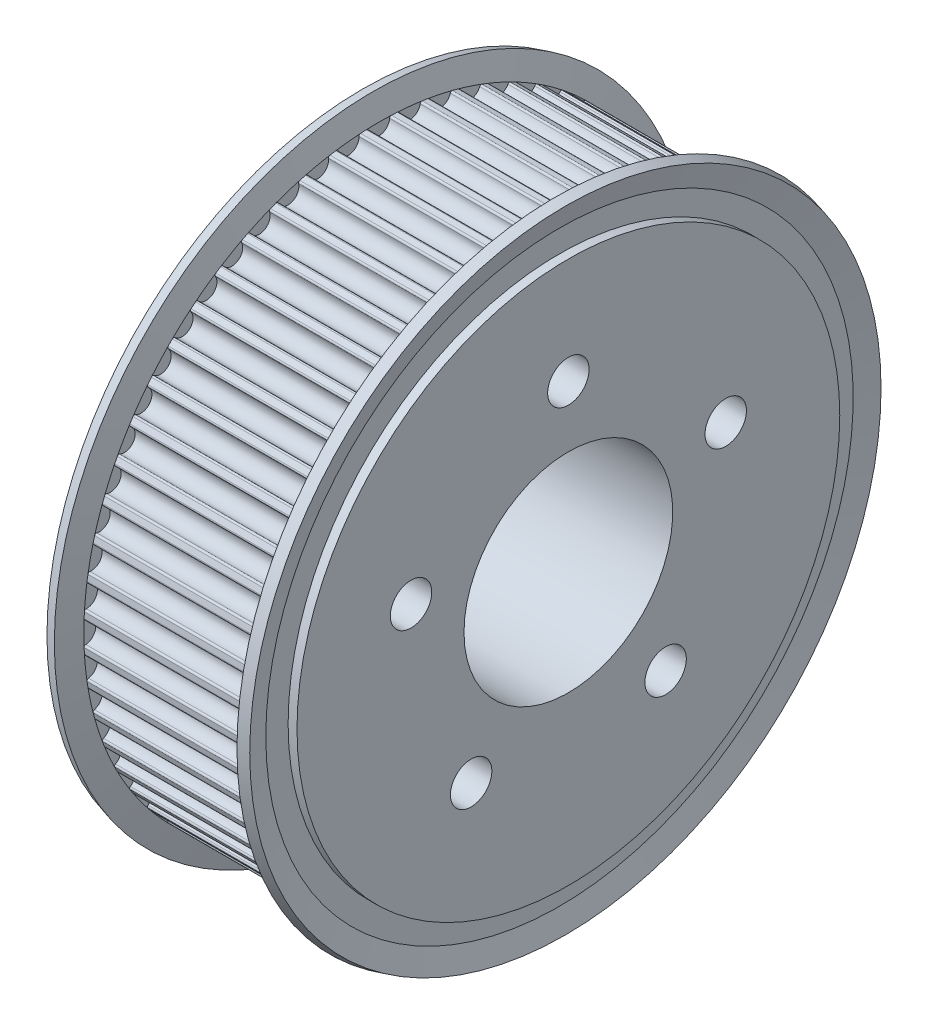
from build123d import *

# Parameters (mm, degrees)
CUT_EXTRUDE1_DEPTH       = 8.15
CUT_EXTRUDE1_DEPTH_BACK  = 8.15
CUT_EXTRUDE2_DEPTH       = 8.15
CUT_EXTRUDE2_DEPTH_BACK  = 8.15
CUT_EXTRUDE3_DEPTH       = 8.15
CUT_EXTRUDE3_DEPTH_BACK  = 8.15
CUT_EXTRUDE4_DEPTH       = 8.15
CUT_EXTRUDE4_DEPTH_BACK  = 8.15
CUT_EXTRUDE5_DEPTH       = 8.15
CUT_EXTRUDE5_DEPTH_BACK  = 8.15
CUT_EXTRUDE6_DEPTH       = 8.15
CUT_EXTRUDE6_DEPTH_BACK  = 8.15
CUT_EXTRUDE7_DEPTH       = 8.15
CUT_EXTRUDE7_DEPTH_BACK  = 8.15
CUT_EXTRUDE8_DEPTH       = 8.15
CUT_EXTRUDE8_DEPTH_BACK  = 8.15
CUT_EXTRUDE9_DEPTH       = 8.15
CUT_EXTRUDE9_DEPTH_BACK  = 8.15
CUT_EXTRUDE10_DEPTH      = 8.15
CUT_EXTRUDE10_DEPTH_BACK = 8.15
CUT_EXTRUDE11_DEPTH      = 8.15
CUT_EXTRUDE11_DEPTH_BACK = 8.15
CUT_EXTRUDE12_DEPTH      = 8.15
CUT_EXTRUDE12_DEPTH_BACK = 8.15
CUT_EXTRUDE13_DEPTH      = 8.15
CUT_EXTRUDE13_DEPTH_BACK = 8.15
CUT_EXTRUDE14_DEPTH      = 8.15
CUT_EXTRUDE14_DEPTH_BACK = 8.15
CUT_EXTRUDE15_DEPTH      = 8.15
CUT_EXTRUDE15_DEPTH_BACK = 8.15
CUT_EXTRUDE16_DEPTH      = 8.15
CUT_EXTRUDE16_DEPTH_BACK = 8.15
CUT_EXTRUDE17_DEPTH      = 8.15
CUT_EXTRUDE17_DEPTH_BACK = 8.15
CUT_EXTRUDE18_DEPTH      = 8.15
CUT_EXTRUDE18_DEPTH_BACK = 8.15
CUT_EXTRUDE19_DEPTH      = 8.15
CUT_EXTRUDE19_DEPTH_BACK = 8.15
CUT_EXTRUDE20_DEPTH      = 8.15
CUT_EXTRUDE20_DEPTH_BACK = 8.15
CUT_EXTRUDE21_DEPTH      = 8.15
CUT_EXTRUDE21_DEPTH_BACK = 8.15
CUT_EXTRUDE22_DEPTH      = 8.15
CUT_EXTRUDE22_DEPTH_BACK = 8.15
CUT_EXTRUDE23_DEPTH      = 8.15
CUT_EXTRUDE23_DEPTH_BACK = 8.15
CUT_EXTRUDE24_DEPTH      = 8.15
CUT_EXTRUDE24_DEPTH_BACK = 8.15
CUT_EXTRUDE25_DEPTH      = 8.15
CUT_EXTRUDE25_DEPTH_BACK = 8.15
CUT_EXTRUDE26_DEPTH      = 8.15
CUT_EXTRUDE26_DEPTH_BACK = 8.15
CUT_EXTRUDE27_DEPTH      = 8.15
CUT_EXTRUDE27_DEPTH_BACK = 8.15
CUT_EXTRUDE28_DEPTH      = 8.15
CUT_EXTRUDE28_DEPTH_BACK = 8.15
CUT_EXTRUDE29_DEPTH      = 8.15
CUT_EXTRUDE29_DEPTH_BACK = 8.15
CUT_EXTRUDE30_DEPTH      = 8.15
CUT_EXTRUDE30_DEPTH_BACK = 8.15
CUT_EXTRUDE31_DEPTH      = 8.15
CUT_EXTRUDE31_DEPTH_BACK = 8.15
CUT_EXTRUDE32_DEPTH      = 8.15
CUT_EXTRUDE32_DEPTH_BACK = 8.15
CUT_EXTRUDE33_DEPTH      = 8.15
CUT_EXTRUDE33_DEPTH_BACK = 8.15
CUT_EXTRUDE34_DEPTH      = 8.15
CUT_EXTRUDE34_DEPTH_BACK = 8.15
CUT_EXTRUDE35_DEPTH      = 8.15
CUT_EXTRUDE35_DEPTH_BACK = 8.15
CUT_EXTRUDE36_DEPTH      = 8.15
CUT_EXTRUDE36_DEPTH_BACK = 8.15
CUT_EXTRUDE37_DEPTH      = 8.15
CUT_EXTRUDE37_DEPTH_BACK = 8.15
CUT_EXTRUDE38_DEPTH      = 8.15
CUT_EXTRUDE38_DEPTH_BACK = 8.15
CUT_EXTRUDE39_DEPTH      = 8.15
CUT_EXTRUDE39_DEPTH_BACK = 8.15
CUT_EXTRUDE40_DEPTH      = 8.15
CUT_EXTRUDE40_DEPTH_BACK = 8.15
CUT_EXTRUDE41_DEPTH      = 8.15
CUT_EXTRUDE41_DEPTH_BACK = 8.15
CUT_EXTRUDE42_DEPTH      = 8.15
CUT_EXTRUDE42_DEPTH_BACK = 8.15
CUT_EXTRUDE43_DEPTH      = 8.15
CUT_EXTRUDE43_DEPTH_BACK = 8.15
CUT_EXTRUDE44_DEPTH      = 8.15
CUT_EXTRUDE44_DEPTH_BACK = 8.15
CUT_EXTRUDE45_DEPTH      = 8.15
CUT_EXTRUDE45_DEPTH_BACK = 8.15
CUT_EXTRUDE46_DEPTH      = 8.15
CUT_EXTRUDE46_DEPTH_BACK = 8.15
CUT_EXTRUDE47_DEPTH      = 8.15
CUT_EXTRUDE47_DEPTH_BACK = 8.15
CUT_EXTRUDE48_DEPTH      = 8.15
CUT_EXTRUDE48_DEPTH_BACK = 8.15
CUT_EXTRUDE49_DEPTH      = 8.15
CUT_EXTRUDE49_DEPTH_BACK = 8.15
CUT_EXTRUDE50_DEPTH      = 8.15
CUT_EXTRUDE50_DEPTH_BACK = 8.15
CUT_EXTRUDE51_DEPTH      = 8.15
CUT_EXTRUDE51_DEPTH_BACK = 8.15
CUT_EXTRUDE52_DEPTH      = 8.15
CUT_EXTRUDE52_DEPTH_BACK = 8.15
CUT_EXTRUDE53_DEPTH      = 8.15
CUT_EXTRUDE53_DEPTH_BACK = 8.15
CUT_EXTRUDE54_DEPTH      = 8.15
CUT_EXTRUDE54_DEPTH_BACK = 8.15
CUT_EXTRUDE55_DEPTH      = 8.15
CUT_EXTRUDE55_DEPTH_BACK = 8.15
CUT_EXTRUDE56_DEPTH      = 8.15
CUT_EXTRUDE56_DEPTH_BACK = 8.15
CUT_EXTRUDE57_DEPTH      = 8.15
CUT_EXTRUDE57_DEPTH_BACK = 8.15
CUT_EXTRUDE58_DEPTH      = 8.15
CUT_EXTRUDE58_DEPTH_BACK = 8.15
CUT_EXTRUDE59_DEPTH      = 8.15
CUT_EXTRUDE59_DEPTH_BACK = 8.15
CUT_EXTRUDE60_DEPTH      = 8.15
CUT_EXTRUDE60_DEPTH_BACK = 8.15
SKETCH62_W               = 20
SKETCH62_H               = 10
SKETCH63_R               = 1.984375
CUT_EXTRUDE61_DEPTH      = 18


with BuildPart() as part:
    # Sketch1 → Revolve1 (revolve)
    with BuildSketch(Plane.XY):
        Polygon((0, 0), (0, 26), (0.85, 26), (0.85, 28.138347502), (0.286547475, 30.241180955), (1.252473301, 30.5), (1.85, 28.27), (18.15, 28.27), (18.747526699, 30.5), (19.713452525, 30.241180955), (19.15, 28.138347502), (19.15, 26), (20, 26), (20, 0), align=None)
    revolve(axis=Axis((20, 0, 0), (-1, 0, 0)))

    # Sketch2 → Cut-Extrude1 (cut, two sides: drawn at the far end of the back side and taken through both)
    with BuildSketch(Plane(origin=(10, 0, 0), x_dir=(0, 0, -1), z_dir=(1, 0, 0)).offset(-CUT_EXTRUDE1_DEPTH_BACK)):
        with BuildLine():
            Line((-1.220377727, 28.623996545), (-1.204191216, 28.244341442))
            ThreePointArc((-1.204191216, 28.244341442), (-1.083780205, 28.201352445), (-1.027381979, 28.086608793))
            ThreePointArc((-1.027381979, 28.086608793), (5e-08, 27.13), (1.027381986, 28.086608894))
            ThreePointArc((1.027381986, 28.086608894), (1.083780242, 28.201352479), (1.204191216, 28.244341442))
            Line((1.204191216, 28.244341442), (1.220377727, 28.623996545))
            ThreePointArc((1.220377727, 28.623996545), (0, 28.65), (-1.220377727, 28.623996545))
        make_face()
    extrude(amount=CUT_EXTRUDE1_DEPTH + CUT_EXTRUDE1_DEPTH_BACK, mode=Mode.SUBTRACT)

    # Sketch3 → Cut-Extrude2 (cut, two sides: drawn at the far end of the back side and taken through both)
    with BuildSketch(Plane(origin=(10, 0, 0), x_dir=(0, 0, -1), z_dir=(1, 0, 0)).offset(-CUT_EXTRUDE2_DEPTH_BACK)):
        with BuildLine():
            Line((-4.205714742, 28.339627088), (-4.149932138, 27.963743727))
            ThreePointArc((-4.149932138, 27.963743727), (-4.025687177, 27.933576607), (-3.957603929, 27.825356752))
            ThreePointArc((-3.957603929, 27.825356752), (-2.835857158, 26.981379027), (-1.914096186, 28.040138172))
            ThreePointArc((-1.914096186, 28.040138172), (-1.870000856, 28.160148403), (-1.754743076, 28.215488242))
            Line((-1.754743076, 28.215488242), (-1.778330001, 28.594755505))
            ThreePointArc((-1.778330001, 28.594755505), (-2.994740473, 28.493052302), (-4.205714742, 28.339627088))
        make_face()
    extrude(amount=CUT_EXTRUDE2_DEPTH + CUT_EXTRUDE2_DEPTH_BACK, mode=Mode.SUBTRACT)

    # Sketch4 → Cut-Extrude3 (cut, two sides: drawn at the far end of the back side and taken through both)
    with BuildSketch(Plane(origin=(10, 0, 0), x_dir=(0, 0, -1), z_dir=(1, 0, 0)).offset(-CUT_EXTRUDE3_DEPTH_BACK)):
        with BuildLine():
            Line((-7.144973065, 27.744762747), (-7.050205534, 27.376769384))
            ThreePointArc((-7.050205534, 27.376769384), (-6.923487877, 27.359754657), (-6.844465541, 27.25924428))
            ThreePointArc((-6.844465541, 27.25924428), (-5.640644123, 26.537144418), (-4.83460312, 27.686453828))
            ThreePointArc((-4.83460312, 27.686453828), (-4.803293833, 27.810415847), (-4.694452036, 27.877500248))
            Line((-4.694452036, 27.877500248), (-4.757553974, 28.252224341))
            ThreePointArc((-4.757553974, 28.252224341), (-5.956669942, 28.023928761), (-7.144973065, 27.744762747))
        make_face()
    extrude(amount=CUT_EXTRUDE3_DEPTH + CUT_EXTRUDE3_DEPTH_BACK, mode=Mode.SUBTRACT)

    # Sketch5 → Cut-Extrude4 (cut, two sides: drawn at the far end of the back side and taken through both)
    with BuildSketch(Plane(origin=(10, 0, 0), x_dir=(0, 0, -1), z_dir=(1, 0, 0)).offset(-CUT_EXTRUDE4_DEPTH_BACK)):
        with BuildLine():
            Line((-10.005949569, 26.845920979), (-9.873235404, 26.489849427))
            ThreePointArc((-9.873235404, 26.489849427), (-9.745433396, 26.48617351), (-9.656337757, 26.394473822))
            ThreePointArc((-9.656337757, 26.394473822), (-8.383631009, 25.802163303), (-7.70214113, 27.029430903))
            ThreePointArc((-7.70214113, 27.029430903), (-7.683960919, 27.155986556), (-7.582727597, 27.234080528))
            Line((-7.582727597, 27.234080528), (-7.68465319, 27.600155894))
            ThreePointArc((-7.68465319, 27.600155894), (-8.853336889, 27.247769192), (-10.005949569, 26.845920979))
        make_face()
    extrude(amount=CUT_EXTRUDE4_DEPTH + CUT_EXTRUDE4_DEPTH_BACK, mode=Mode.SUBTRACT)

    # Sketch6 → Cut-Extrude5 (cut, two sides: drawn at the far end of the back side and taken through both)
    with BuildSketch(Plane(origin=(10, 0, 0), x_dir=(0, 0, -1), z_dir=(1, 0, 0)).offset(-CUT_EXTRUDE5_DEPTH_BACK)):
        with BuildLine():
            Line((-12.757298795, 25.652949683), (-12.58809204, 25.312701136))
            ThreePointArc((-12.58809204, 25.312701136), (-12.460605907, 25.322404304), (-12.362413116, 25.240519986))
            ThreePointArc((-12.362413116, 25.240519986), (-11.034765081, 24.784488286), (-10.48529287, 26.076267876))
            ThreePointArc((-10.48529287, 26.076267876), (-10.48044092, 26.204030594), (-10.387925208, 26.292278522))
            Line((-10.387925208, 26.292278522), (-10.527557737, 26.645694363))
            ThreePointArc((-10.527557737, 26.645694363), (-11.653004824, 26.173077361), (-12.757298795, 25.652949683))
        make_face()
    extrude(amount=CUT_EXTRUDE5_DEPTH + CUT_EXTRUDE5_DEPTH_BACK, mode=Mode.SUBTRACT)

    # Sketch7 → Cut-Extrude6 (cut, two sides: drawn at the far end of the back side and taken through both)
    with BuildSketch(Plane(origin=(10, 0, 0), x_dir=(0, 0, -1), z_dir=(1, 0, 0)).offset(-CUT_EXTRUDE6_DEPTH_BACK)):
        with BuildLine():
            Line((-15.368876386, 24.178919302), (-15.165030906, 23.858221594))
            ThreePointArc((-15.165030906, 23.858221594), (-15.039257412, 23.881197536), (-14.93304329, 23.810025732))
            ThreePointArc((-14.93304329, 23.810025732), (-13.564999956, 23.49526923), (-13.153565547, 24.837407801))
            ThreePointArc((-13.153565547, 24.837407801), (-13.162095017, 24.964977789), (-13.079310537, 25.06241281))
            Line((-13.079310537, 25.06241281), (-13.255120158, 25.399297029))
            ThreePointArc((-13.255120158, 25.399297029), (-14.325, 24.811627818), (-15.368876386, 24.178919302))
        make_face()
    extrude(amount=CUT_EXTRUDE6_DEPTH + CUT_EXTRUDE6_DEPTH_BACK, mode=Mode.SUBTRACT)

    # Sketch8 → Cut-Extrude7 (cut, two sides: drawn at the far end of the back side and taken through both)
    with BuildSketch(Plane(origin=(10, 0, 0), x_dir=(0, 0, -1), z_dir=(1, 0, 0)).offset(-CUT_EXTRUDE7_DEPTH_BACK)):
        with BuildLine():
            Line((-17.812069352, 22.439979621), (-17.575818519, 22.142346384))
            ThreePointArc((-17.575818519, 22.142346384), (-17.453135666, 22.178343372), (-17.340063916, 22.118663852))
            ThreePointArc((-17.340063916, 22.118663852), (-15.946613854, 21.948631087), (-15.677725008, 23.326423889))
            ThreePointArc((-15.677725008, 23.326423889), (-15.699542448, 23.452403463), (-15.627396202, 23.55795806))
            Line((-15.627396202, 23.55795806), (-15.83745671, 23.874619682))
            ThreePointArc((-15.83745671, 23.874619682), (-16.840047478, 23.178336889), (-17.812069352, 22.439979621))
        make_face()
    extrude(amount=CUT_EXTRUDE7_DEPTH + CUT_EXTRUDE7_DEPTH_BACK, mode=Mode.SUBTRACT)

    # Sketch9 → Cut-Extrude8 (cut, two sides: drawn at the far end of the back side and taken through both)
    with BuildSketch(Plane(origin=(10, 0, 0), x_dir=(0, 0, -1), z_dir=(1, 0, 0)).offset(-CUT_EXTRUDE8_DEPTH_BACK)):
        with BuildLine():
            Line((-20.060109558, 20.455182828), (-19.794041787, 20.183874993))
            ThreePointArc((-19.794041787, 20.183874993), (-19.675793713, 20.232498636), (-19.557103174, 20.184965263))
            ThreePointArc((-19.557103174, 20.184965263), (-18.153513313, 20.161519149), (-18.030116033, 21.559870796))
            ThreePointArc((-18.030116033, 21.559870796), (-18.064982405, 21.682879697), (-18.004264844, 21.795397391))
            Line((-18.004264844, 21.795397391), (-18.246274771, 22.088367005))
            ThreePointArc((-18.246274771, 22.088367005), (-19.170591872, 21.29109925), (-20.060109558, 20.455182828))
        make_face()
    extrude(amount=CUT_EXTRUDE8_DEPTH + CUT_EXTRUDE8_DEPTH_BACK, mode=Mode.SUBTRACT)

    # Sketch10 → Cut-Extrude9 (cut, two sides: drawn at the far end of the back side and taken through both)
    with BuildSketch(Plane(origin=(10, 0, 0), x_dir=(0, 0, -1), z_dir=(1, 0, 0)).offset(-CUT_EXTRUDE9_DEPTH_BACK)):
        with BuildLine():
            Line((-22.088367005, 18.246274771), (-21.795397391, 18.004264844))
            ThreePointArc((-21.795397391, 18.004264844), (-21.682879647, 18.064982411), (-21.559870717, 18.030115971))
            ThreePointArc((-21.559870717, 18.030115971), (-20.161519081, 18.153513388), (-20.184965333, 19.557103247))
            ThreePointArc((-20.184965333, 19.557103247), (-20.232498635, 19.675793763), (-20.183874993, 19.794041787))
            Line((-20.183874993, 19.794041787), (-20.455182828, 20.060109558))
            ThreePointArc((-20.455182828, 20.060109558), (-21.29109925, 19.170591872), (-22.088367005, 18.246274771))
        make_face()
    extrude(amount=CUT_EXTRUDE9_DEPTH + CUT_EXTRUDE9_DEPTH_BACK, mode=Mode.SUBTRACT)

    # Sketch11 → Cut-Extrude10 (cut, two sides: drawn at the far end of the back side and taken through both)
    with BuildSketch(Plane(origin=(10, 0, 0), x_dir=(0, 0, -1), z_dir=(1, 0, 0)).offset(-CUT_EXTRUDE10_DEPTH_BACK)):
        with BuildLine():
            Line((-23.874619682, 15.83745671), (-23.55795806, 15.627396202))
            ThreePointArc((-23.55795806, 15.627396202), (-23.452403414, 15.699542458), (-23.326423804, 15.677724955))
            ThreePointArc((-23.326423804, 15.677724955), (-21.948631028, 15.946613935), (-22.11866393, 17.340063981))
            ThreePointArc((-22.11866393, 17.340063981), (-22.178343377, 17.453135716), (-22.142346384, 17.575818519))
            Line((-22.142346384, 17.575818519), (-22.439979621, 17.812069352))
            ThreePointArc((-22.439979621, 17.812069352), (-23.178336889, 16.840047478), (-23.874619682, 15.83745671))
        make_face()
    extrude(amount=CUT_EXTRUDE10_DEPTH + CUT_EXTRUDE10_DEPTH_BACK, mode=Mode.SUBTRACT)

    # Sketch12 → Cut-Extrude11 (cut, two sides: drawn at the far end of the back side and taken through both)
    with BuildSketch(Plane(origin=(10, 0, 0), x_dir=(0, 0, -1), z_dir=(1, 0, 0)).offset(-CUT_EXTRUDE11_DEPTH_BACK)):
        with BuildLine():
            Line((-25.399297029, 13.255120158), (-25.06241281, 13.079310537))
            ThreePointArc((-25.06241281, 13.079310537), (-24.964977741, 13.162095033), (-24.837407711, 13.153565503))
            ThreePointArc((-24.837407711, 13.153565503), (-23.495269179, 13.565000044), (-23.810025815, 14.933043346))
            ThreePointArc((-23.810025815, 14.933043346), (-23.881197547, 15.039257461), (-23.858221594, 15.165030906))
            Line((-23.858221594, 15.165030906), (-24.178919302, 15.368876386))
            ThreePointArc((-24.178919302, 15.368876386), (-24.811627818, 14.325), (-25.399297029, 13.255120158))
        make_face()
    extrude(amount=CUT_EXTRUDE11_DEPTH + CUT_EXTRUDE11_DEPTH_BACK, mode=Mode.SUBTRACT)

    # Sketch13 → Cut-Extrude12 (cut, two sides: drawn at the far end of the back side and taken through both)
    with BuildSketch(Plane(origin=(10, 0, 0), x_dir=(0, 0, -1), z_dir=(1, 0, 0)).offset(-CUT_EXTRUDE12_DEPTH_BACK)):
        with BuildLine():
            Line((-26.645694363, 10.527557737), (-26.292278522, 10.387925208))
            ThreePointArc((-26.292278522, 10.387925208), (-26.204030548, 10.480440941), (-26.076267781, 10.485292836))
            ThreePointArc((-26.076267781, 10.485292836), (-24.784488245, 11.034765173), (-25.240520075, 12.362413164))
            ThreePointArc((-25.240520075, 12.362413164), (-25.322404319, 12.460605955), (-25.312701136, 12.58809204))
            Line((-25.312701136, 12.58809204), (-25.652949683, 12.757298795))
            ThreePointArc((-25.652949683, 12.757298795), (-26.173077361, 11.653004824), (-26.645694363, 10.527557737))
        make_face()
    extrude(amount=CUT_EXTRUDE12_DEPTH + CUT_EXTRUDE12_DEPTH_BACK, mode=Mode.SUBTRACT)

    # Sketch14 → Cut-Extrude13 (cut, two sides: drawn at the far end of the back side and taken through both)
    with BuildSketch(Plane(origin=(10, 0, 0), x_dir=(0, 0, -1), z_dir=(1, 0, 0)).offset(-CUT_EXTRUDE13_DEPTH_BACK)):
        with BuildLine():
            Line((-27.600155894, 7.68465319), (-27.234080528, 7.582727597))
            ThreePointArc((-27.234080528, 7.582727597), (-27.155986513, 7.683960944), (-27.029430805, 7.702141106))
            ThreePointArc((-27.029430805, 7.702141106), (-25.802163272, 8.383631105), (-26.394473916, 9.656337795))
            ThreePointArc((-26.394473916, 9.656337795), (-26.48617353, 9.745433442), (-26.489849427, 9.873235404))
            Line((-26.489849427, 9.873235404), (-26.845920979, 10.005949569))
            ThreePointArc((-26.845920979, 10.005949569), (-27.247769192, 8.853336889), (-27.600155894, 7.68465319))
        make_face()
    extrude(amount=CUT_EXTRUDE13_DEPTH + CUT_EXTRUDE13_DEPTH_BACK, mode=Mode.SUBTRACT)

    # Sketch15 → Cut-Extrude14 (cut, two sides: drawn at the far end of the back side and taken through both)
    with BuildSketch(Plane(origin=(10, 0, 0), x_dir=(0, 0, -1), z_dir=(1, 0, 0)).offset(-CUT_EXTRUDE14_DEPTH_BACK)):
        with BuildLine():
            Line((-28.252224341, 4.757553974), (-27.877500248, 4.694452036))
            ThreePointArc((-27.877500248, 4.694452036), (-27.810415807, 4.803293863), (-27.686453728, 4.834603106))
            ThreePointArc((-27.686453728, 4.834603106), (-26.537144397, 5.640644221), (-27.259244376, 6.844465569))
            ThreePointArc((-27.259244376, 6.844465569), (-27.359754682, 6.923487921), (-27.376769384, 7.050205534))
            Line((-27.376769384, 7.050205534), (-27.744762747, 7.144973065))
            ThreePointArc((-27.744762747, 7.144973065), (-28.023928761, 5.956669942), (-28.252224341, 4.757553974))
        make_face()
    extrude(amount=CUT_EXTRUDE14_DEPTH + CUT_EXTRUDE14_DEPTH_BACK, mode=Mode.SUBTRACT)

    # Sketch16 → Cut-Extrude15 (cut, two sides: drawn at the far end of the back side and taken through both)
    with BuildSketch(Plane(origin=(10, 0, 0), x_dir=(0, 0, -1), z_dir=(1, 0, 0)).offset(-CUT_EXTRUDE15_DEPTH_BACK)):
        with BuildLine():
            Line((-28.594755505, 1.778330001), (-28.215488242, 1.754743076))
            ThreePointArc((-28.215488242, 1.754743076), (-28.160148365, 1.87000089), (-28.040138071, 1.914096183))
            ThreePointArc((-28.040138071, 1.914096183), (-26.981379016, 2.835857259), (-27.825356851, 3.957603946))
            ThreePointArc((-27.825356851, 3.957603946), (-27.933576636, 4.025687218), (-27.963743727, 4.149932138))
            Line((-27.963743727, 4.149932138), (-28.339627088, 4.205714742))
            ThreePointArc((-28.339627088, 4.205714742), (-28.493052302, 2.994740473), (-28.594755505, 1.778330001))
        make_face()
    extrude(amount=CUT_EXTRUDE15_DEPTH + CUT_EXTRUDE15_DEPTH_BACK, mode=Mode.SUBTRACT)

    # Sketch17 → Cut-Extrude16 (cut, two sides: drawn at the far end of the back side and taken through both)
    with BuildSketch(Plane(origin=(10, 0, 0), x_dir=(0, 0, -1), z_dir=(1, 0, 0)).offset(-CUT_EXTRUDE16_DEPTH_BACK)):
        with BuildLine():
            Line((-28.623996545, -1.220377727), (-28.244341442, -1.204191216))
            ThreePointArc((-28.244341442, -1.204191216), (-28.201352445, -1.083780205), (-28.086608793, -1.027381979))
            ThreePointArc((-28.086608793, -1.027381979), (-27.13, 5e-08), (-28.086608894, 1.027381986))
            ThreePointArc((-28.086608894, 1.027381986), (-28.201352479, 1.083780242), (-28.244341442, 1.204191216))
            Line((-28.244341442, 1.204191216), (-28.623996545, 1.220377727))
            ThreePointArc((-28.623996545, 1.220377727), (-28.65, 0), (-28.623996545, -1.220377727))
        make_face()
    extrude(amount=CUT_EXTRUDE16_DEPTH + CUT_EXTRUDE16_DEPTH_BACK, mode=Mode.SUBTRACT)

    # Sketch18 → Cut-Extrude17 (cut, two sides: drawn at the far end of the back side and taken through both)
    with BuildSketch(Plane(origin=(10, 0, 0), x_dir=(0, 0, -1), z_dir=(1, 0, 0)).offset(-CUT_EXTRUDE17_DEPTH_BACK)):
        with BuildLine():
            Line((-28.339627088, -4.205714742), (-27.963743727, -4.149932138))
            ThreePointArc((-27.963743727, -4.149932138), (-27.933576607, -4.025687177), (-27.825356752, -3.957603929))
            ThreePointArc((-27.825356752, -3.957603929), (-26.981379027, -2.835857158), (-28.040138172, -1.914096186))
            ThreePointArc((-28.040138172, -1.914096186), (-28.160148403, -1.870000856), (-28.215488242, -1.754743076))
            Line((-28.215488242, -1.754743076), (-28.594755505, -1.778330001))
            ThreePointArc((-28.594755505, -1.778330001), (-28.493052302, -2.994740473), (-28.339627088, -4.205714742))
        make_face()
    extrude(amount=CUT_EXTRUDE17_DEPTH + CUT_EXTRUDE17_DEPTH_BACK, mode=Mode.SUBTRACT)

    # Sketch19 → Cut-Extrude18 (cut, two sides: drawn at the far end of the back side and taken through both)
    with BuildSketch(Plane(origin=(10, 0, 0), x_dir=(0, 0, -1), z_dir=(1, 0, 0)).offset(-CUT_EXTRUDE18_DEPTH_BACK)):
        with BuildLine():
            Line((-27.744762747, -7.144973065), (-27.376769384, -7.050205534))
            ThreePointArc((-27.376769384, -7.050205534), (-27.359754657, -6.923487877), (-27.25924428, -6.844465541))
            ThreePointArc((-27.25924428, -6.844465541), (-26.537144418, -5.640644123), (-27.686453828, -4.83460312))
            ThreePointArc((-27.686453828, -4.83460312), (-27.810415847, -4.803293833), (-27.877500248, -4.694452036))
            Line((-27.877500248, -4.694452036), (-28.252224341, -4.757553974))
            ThreePointArc((-28.252224341, -4.757553974), (-28.023928761, -5.956669942), (-27.744762747, -7.144973065))
        make_face()
    extrude(amount=CUT_EXTRUDE18_DEPTH + CUT_EXTRUDE18_DEPTH_BACK, mode=Mode.SUBTRACT)

    # Sketch20 → Cut-Extrude19 (cut, two sides: drawn at the far end of the back side and taken through both)
    with BuildSketch(Plane(origin=(10, 0, 0), x_dir=(0, 0, -1), z_dir=(1, 0, 0)).offset(-CUT_EXTRUDE19_DEPTH_BACK)):
        with BuildLine():
            Line((-26.845920979, -10.005949569), (-26.489849427, -9.873235404))
            ThreePointArc((-26.489849427, -9.873235404), (-26.48617351, -9.745433396), (-26.394473822, -9.656337757))
            ThreePointArc((-26.394473822, -9.656337757), (-25.802163303, -8.383631009), (-27.029430903, -7.70214113))
            ThreePointArc((-27.029430903, -7.70214113), (-27.155986556, -7.683960919), (-27.234080528, -7.582727597))
            Line((-27.234080528, -7.582727597), (-27.600155894, -7.68465319))
            ThreePointArc((-27.600155894, -7.68465319), (-27.247769192, -8.853336889), (-26.845920979, -10.005949569))
        make_face()
    extrude(amount=CUT_EXTRUDE19_DEPTH + CUT_EXTRUDE19_DEPTH_BACK, mode=Mode.SUBTRACT)

    # Sketch21 → Cut-Extrude20 (cut, two sides: drawn at the far end of the back side and taken through both)
    with BuildSketch(Plane(origin=(10, 0, 0), x_dir=(0, 0, -1), z_dir=(1, 0, 0)).offset(-CUT_EXTRUDE20_DEPTH_BACK)):
        with BuildLine():
            Line((-25.652949683, -12.757298795), (-25.312701136, -12.58809204))
            ThreePointArc((-25.312701136, -12.58809204), (-25.322404304, -12.460605907), (-25.240519986, -12.362413116))
            ThreePointArc((-25.240519986, -12.362413116), (-24.784488286, -11.034765081), (-26.076267876, -10.48529287))
            ThreePointArc((-26.076267876, -10.48529287), (-26.204030594, -10.48044092), (-26.292278522, -10.387925208))
            Line((-26.292278522, -10.387925208), (-26.645694363, -10.527557737))
            ThreePointArc((-26.645694363, -10.527557737), (-26.173077361, -11.653004824), (-25.652949683, -12.757298795))
        make_face()
    extrude(amount=CUT_EXTRUDE20_DEPTH + CUT_EXTRUDE20_DEPTH_BACK, mode=Mode.SUBTRACT)

    # Sketch22 → Cut-Extrude21 (cut, two sides: drawn at the far end of the back side and taken through both)
    with BuildSketch(Plane(origin=(10, 0, 0), x_dir=(0, 0, -1), z_dir=(1, 0, 0)).offset(-CUT_EXTRUDE21_DEPTH_BACK)):
        with BuildLine():
            Line((-24.178919302, -15.368876386), (-23.858221594, -15.165030906))
            ThreePointArc((-23.858221594, -15.165030906), (-23.881197536, -15.039257412), (-23.810025732, -14.93304329))
            ThreePointArc((-23.810025732, -14.93304329), (-23.49526923, -13.564999956), (-24.837407801, -13.153565547))
            ThreePointArc((-24.837407801, -13.153565547), (-24.964977789, -13.162095017), (-25.06241281, -13.079310537))
            Line((-25.06241281, -13.079310537), (-25.399297029, -13.255120158))
            ThreePointArc((-25.399297029, -13.255120158), (-24.811627818, -14.325), (-24.178919302, -15.368876386))
        make_face()
    extrude(amount=CUT_EXTRUDE21_DEPTH + CUT_EXTRUDE21_DEPTH_BACK, mode=Mode.SUBTRACT)

    # Sketch23 → Cut-Extrude22 (cut, two sides: drawn at the far end of the back side and taken through both)
    with BuildSketch(Plane(origin=(10, 0, 0), x_dir=(0, 0, -1), z_dir=(1, 0, 0)).offset(-CUT_EXTRUDE22_DEPTH_BACK)):
        with BuildLine():
            Line((-22.439979621, -17.812069352), (-22.142346384, -17.575818519))
            ThreePointArc((-22.142346384, -17.575818519), (-22.178343372, -17.453135666), (-22.118663852, -17.340063916))
            ThreePointArc((-22.118663852, -17.340063916), (-21.948631087, -15.946613854), (-23.326423889, -15.677725008))
            ThreePointArc((-23.326423889, -15.677725008), (-23.452403463, -15.699542448), (-23.55795806, -15.627396202))
            Line((-23.55795806, -15.627396202), (-23.874619682, -15.83745671))
            ThreePointArc((-23.874619682, -15.83745671), (-23.178336889, -16.840047478), (-22.439979621, -17.812069352))
        make_face()
    extrude(amount=CUT_EXTRUDE22_DEPTH + CUT_EXTRUDE22_DEPTH_BACK, mode=Mode.SUBTRACT)

    # Sketch24 → Cut-Extrude23 (cut, two sides: drawn at the far end of the back side and taken through both)
    with BuildSketch(Plane(origin=(10, 0, 0), x_dir=(0, 0, -1), z_dir=(1, 0, 0)).offset(-CUT_EXTRUDE23_DEPTH_BACK)):
        with BuildLine():
            Line((-20.455182828, -20.060109558), (-20.183874993, -19.794041787))
            ThreePointArc((-20.183874993, -19.794041787), (-20.232498636, -19.675793713), (-20.184965263, -19.557103174))
            ThreePointArc((-20.184965263, -19.557103174), (-20.161519149, -18.153513313), (-21.559870796, -18.030116033))
            ThreePointArc((-21.559870796, -18.030116033), (-21.682879697, -18.064982405), (-21.795397391, -18.004264844))
            Line((-21.795397391, -18.004264844), (-22.088367005, -18.246274771))
            ThreePointArc((-22.088367005, -18.246274771), (-21.29109925, -19.170591872), (-20.455182828, -20.060109558))
        make_face()
    extrude(amount=CUT_EXTRUDE23_DEPTH + CUT_EXTRUDE23_DEPTH_BACK, mode=Mode.SUBTRACT)

    # Sketch25 → Cut-Extrude24 (cut, two sides: drawn at the far end of the back side and taken through both)
    with BuildSketch(Plane(origin=(10, 0, 0), x_dir=(0, 0, -1), z_dir=(1, 0, 0)).offset(-CUT_EXTRUDE24_DEPTH_BACK)):
        with BuildLine():
            Line((-18.246274771, -22.088367005), (-18.004264844, -21.795397391))
            ThreePointArc((-18.004264844, -21.795397391), (-18.064982411, -21.682879647), (-18.030115971, -21.559870717))
            ThreePointArc((-18.030115971, -21.559870717), (-18.153513388, -20.161519081), (-19.557103247, -20.184965333))
            ThreePointArc((-19.557103247, -20.184965333), (-19.675793763, -20.232498635), (-19.794041787, -20.183874993))
            Line((-19.794041787, -20.183874993), (-20.060109558, -20.455182828))
            ThreePointArc((-20.060109558, -20.455182828), (-19.170591872, -21.29109925), (-18.246274771, -22.088367005))
        make_face()
    extrude(amount=CUT_EXTRUDE24_DEPTH + CUT_EXTRUDE24_DEPTH_BACK, mode=Mode.SUBTRACT)

    # Sketch26 → Cut-Extrude25 (cut, two sides: drawn at the far end of the back side and taken through both)
    with BuildSketch(Plane(origin=(10, 0, 0), x_dir=(0, 0, -1), z_dir=(1, 0, 0)).offset(-CUT_EXTRUDE25_DEPTH_BACK)):
        with BuildLine():
            Line((-15.83745671, -23.874619682), (-15.627396202, -23.55795806))
            ThreePointArc((-15.627396202, -23.55795806), (-15.699542458, -23.452403414), (-15.677724955, -23.326423804))
            ThreePointArc((-15.677724955, -23.326423804), (-15.946613935, -21.948631028), (-17.340063981, -22.11866393))
            ThreePointArc((-17.340063981, -22.11866393), (-17.453135716, -22.178343377), (-17.575818519, -22.142346384))
            Line((-17.575818519, -22.142346384), (-17.812069352, -22.439979621))
            ThreePointArc((-17.812069352, -22.439979621), (-16.840047478, -23.178336889), (-15.83745671, -23.874619682))
        make_face()
    extrude(amount=CUT_EXTRUDE25_DEPTH + CUT_EXTRUDE25_DEPTH_BACK, mode=Mode.SUBTRACT)

    # Sketch27 → Cut-Extrude26 (cut, two sides: drawn at the far end of the back side and taken through both)
    with BuildSketch(Plane(origin=(10, 0, 0), x_dir=(0, 0, -1), z_dir=(1, 0, 0)).offset(-CUT_EXTRUDE26_DEPTH_BACK)):
        with BuildLine():
            Line((-13.255120158, -25.399297029), (-13.079310537, -25.06241281))
            ThreePointArc((-13.079310537, -25.06241281), (-13.162095033, -24.964977741), (-13.153565503, -24.837407711))
            ThreePointArc((-13.153565503, -24.837407711), (-13.565000044, -23.495269179), (-14.933043346, -23.810025815))
            ThreePointArc((-14.933043346, -23.810025815), (-15.039257461, -23.881197547), (-15.165030906, -23.858221594))
            Line((-15.165030906, -23.858221594), (-15.368876386, -24.178919302))
            ThreePointArc((-15.368876386, -24.178919302), (-14.325, -24.811627818), (-13.255120158, -25.399297029))
        make_face()
    extrude(amount=CUT_EXTRUDE26_DEPTH + CUT_EXTRUDE26_DEPTH_BACK, mode=Mode.SUBTRACT)

    # Sketch28 → Cut-Extrude27 (cut, two sides: drawn at the far end of the back side and taken through both)
    with BuildSketch(Plane(origin=(10, 0, 0), x_dir=(0, 0, -1), z_dir=(1, 0, 0)).offset(-CUT_EXTRUDE27_DEPTH_BACK)):
        with BuildLine():
            Line((-10.527557737, -26.645694363), (-10.387925208, -26.292278522))
            ThreePointArc((-10.387925208, -26.292278522), (-10.480440941, -26.204030548), (-10.485292836, -26.076267781))
            ThreePointArc((-10.485292836, -26.076267781), (-11.034765173, -24.784488245), (-12.362413164, -25.240520075))
            ThreePointArc((-12.362413164, -25.240520075), (-12.460605955, -25.322404319), (-12.58809204, -25.312701136))
            Line((-12.58809204, -25.312701136), (-12.757298795, -25.652949683))
            ThreePointArc((-12.757298795, -25.652949683), (-11.653004824, -26.173077361), (-10.527557737, -26.645694363))
        make_face()
    extrude(amount=CUT_EXTRUDE27_DEPTH + CUT_EXTRUDE27_DEPTH_BACK, mode=Mode.SUBTRACT)

    # Sketch29 → Cut-Extrude28 (cut, two sides: drawn at the far end of the back side and taken through both)
    with BuildSketch(Plane(origin=(10, 0, 0), x_dir=(0, 0, -1), z_dir=(1, 0, 0)).offset(-CUT_EXTRUDE28_DEPTH_BACK)):
        with BuildLine():
            Line((-7.68465319, -27.600155894), (-7.582727597, -27.234080528))
            ThreePointArc((-7.582727597, -27.234080528), (-7.683960944, -27.155986513), (-7.702141106, -27.029430805))
            ThreePointArc((-7.702141106, -27.029430805), (-8.383631105, -25.802163272), (-9.656337795, -26.394473916))
            ThreePointArc((-9.656337795, -26.394473916), (-9.745433442, -26.48617353), (-9.873235404, -26.489849427))
            Line((-9.873235404, -26.489849427), (-10.005949569, -26.845920979))
            ThreePointArc((-10.005949569, -26.845920979), (-8.853336889, -27.247769192), (-7.68465319, -27.600155894))
        make_face()
    extrude(amount=CUT_EXTRUDE28_DEPTH + CUT_EXTRUDE28_DEPTH_BACK, mode=Mode.SUBTRACT)

    # Sketch30 → Cut-Extrude29 (cut, two sides: drawn at the far end of the back side and taken through both)
    with BuildSketch(Plane(origin=(10, 0, 0), x_dir=(0, 0, -1), z_dir=(1, 0, 0)).offset(-CUT_EXTRUDE29_DEPTH_BACK)):
        with BuildLine():
            Line((-4.757553974, -28.252224341), (-4.694452036, -27.877500248))
            ThreePointArc((-4.694452036, -27.877500248), (-4.803293863, -27.810415807), (-4.834603106, -27.686453728))
            ThreePointArc((-4.834603106, -27.686453728), (-5.640644221, -26.537144397), (-6.844465569, -27.259244376))
            ThreePointArc((-6.844465569, -27.259244376), (-6.923487921, -27.359754682), (-7.050205534, -27.376769384))
            Line((-7.050205534, -27.376769384), (-7.144973065, -27.744762747))
            ThreePointArc((-7.144973065, -27.744762747), (-5.956669942, -28.023928761), (-4.757553974, -28.252224341))
        make_face()
    extrude(amount=CUT_EXTRUDE29_DEPTH + CUT_EXTRUDE29_DEPTH_BACK, mode=Mode.SUBTRACT)

    # Sketch31 → Cut-Extrude30 (cut, two sides: drawn at the far end of the back side and taken through both)
    with BuildSketch(Plane(origin=(10, 0, 0), x_dir=(0, 0, -1), z_dir=(1, 0, 0)).offset(-CUT_EXTRUDE30_DEPTH_BACK)):
        with BuildLine():
            Line((-1.778330001, -28.594755505), (-1.754743076, -28.215488242))
            ThreePointArc((-1.754743076, -28.215488242), (-1.87000089, -28.160148365), (-1.914096183, -28.040138071))
            ThreePointArc((-1.914096183, -28.040138071), (-2.835857259, -26.981379016), (-3.957603946, -27.825356851))
            ThreePointArc((-3.957603946, -27.825356851), (-4.025687218, -27.933576636), (-4.149932138, -27.963743727))
            Line((-4.149932138, -27.963743727), (-4.205714742, -28.339627088))
            ThreePointArc((-4.205714742, -28.339627088), (-2.994740473, -28.493052302), (-1.778330001, -28.594755505))
        make_face()
    extrude(amount=CUT_EXTRUDE30_DEPTH + CUT_EXTRUDE30_DEPTH_BACK, mode=Mode.SUBTRACT)

    # Sketch32 → Cut-Extrude31 (cut, two sides: drawn at the far end of the back side and taken through both)
    with BuildSketch(Plane(origin=(10, 0, 0), x_dir=(0, 0, -1), z_dir=(1, 0, 0)).offset(-CUT_EXTRUDE31_DEPTH_BACK)):
        with BuildLine():
            Line((1.220377727, -28.623996545), (1.204191216, -28.244341442))
            ThreePointArc((1.204191216, -28.244341442), (1.083780205, -28.201352445), (1.027381979, -28.086608793))
            ThreePointArc((1.027381979, -28.086608793), (-5e-08, -27.13), (-1.027381986, -28.086608894))
            ThreePointArc((-1.027381986, -28.086608894), (-1.083780242, -28.201352479), (-1.204191216, -28.244341442))
            Line((-1.204191216, -28.244341442), (-1.220377727, -28.623996545))
            ThreePointArc((-1.220377727, -28.623996545), (0, -28.65), (1.220377727, -28.623996545))
        make_face()
    extrude(amount=CUT_EXTRUDE31_DEPTH + CUT_EXTRUDE31_DEPTH_BACK, mode=Mode.SUBTRACT)

    # Sketch33 → Cut-Extrude32 (cut, two sides: drawn at the far end of the back side and taken through both)
    with BuildSketch(Plane(origin=(10, 0, 0), x_dir=(0, 0, -1), z_dir=(1, 0, 0)).offset(-CUT_EXTRUDE32_DEPTH_BACK)):
        with BuildLine():
            Line((4.205714742, -28.339627088), (4.149932138, -27.963743727))
            ThreePointArc((4.149932138, -27.963743727), (4.025687177, -27.933576607), (3.957603929, -27.825356752))
            ThreePointArc((3.957603929, -27.825356752), (2.835857158, -26.981379027), (1.914096186, -28.040138172))
            ThreePointArc((1.914096186, -28.040138172), (1.870000856, -28.160148403), (1.754743076, -28.215488242))
            Line((1.754743076, -28.215488242), (1.778330001, -28.594755505))
            ThreePointArc((1.778330001, -28.594755505), (2.994740473, -28.493052302), (4.205714742, -28.339627088))
        make_face()
    extrude(amount=CUT_EXTRUDE32_DEPTH + CUT_EXTRUDE32_DEPTH_BACK, mode=Mode.SUBTRACT)

    # Sketch34 → Cut-Extrude33 (cut, two sides: drawn at the far end of the back side and taken through both)
    with BuildSketch(Plane(origin=(10, 0, 0), x_dir=(0, 0, -1), z_dir=(1, 0, 0)).offset(-CUT_EXTRUDE33_DEPTH_BACK)):
        with BuildLine():
            Line((7.144973065, -27.744762747), (7.050205534, -27.376769384))
            ThreePointArc((7.050205534, -27.376769384), (6.923487877, -27.359754657), (6.844465541, -27.25924428))
            ThreePointArc((6.844465541, -27.25924428), (5.640644123, -26.537144418), (4.83460312, -27.686453828))
            ThreePointArc((4.83460312, -27.686453828), (4.803293833, -27.810415847), (4.694452036, -27.877500248))
            Line((4.694452036, -27.877500248), (4.757553974, -28.252224341))
            ThreePointArc((4.757553974, -28.252224341), (5.956669942, -28.023928761), (7.144973065, -27.744762747))
        make_face()
    extrude(amount=CUT_EXTRUDE33_DEPTH + CUT_EXTRUDE33_DEPTH_BACK, mode=Mode.SUBTRACT)

    # Sketch35 → Cut-Extrude34 (cut, two sides: drawn at the far end of the back side and taken through both)
    with BuildSketch(Plane(origin=(10, 0, 0), x_dir=(0, 0, -1), z_dir=(1, 0, 0)).offset(-CUT_EXTRUDE34_DEPTH_BACK)):
        with BuildLine():
            Line((10.005949569, -26.845920979), (9.873235404, -26.489849427))
            ThreePointArc((9.873235404, -26.489849427), (9.745433396, -26.48617351), (9.656337757, -26.394473822))
            ThreePointArc((9.656337757, -26.394473822), (8.383631009, -25.802163303), (7.70214113, -27.029430903))
            ThreePointArc((7.70214113, -27.029430903), (7.683960919, -27.155986556), (7.582727597, -27.234080528))
            Line((7.582727597, -27.234080528), (7.68465319, -27.600155894))
            ThreePointArc((7.68465319, -27.600155894), (8.853336889, -27.247769192), (10.005949569, -26.845920979))
        make_face()
    extrude(amount=CUT_EXTRUDE34_DEPTH + CUT_EXTRUDE34_DEPTH_BACK, mode=Mode.SUBTRACT)

    # Sketch36 → Cut-Extrude35 (cut, two sides: drawn at the far end of the back side and taken through both)
    with BuildSketch(Plane(origin=(10, 0, 0), x_dir=(0, 0, -1), z_dir=(1, 0, 0)).offset(-CUT_EXTRUDE35_DEPTH_BACK)):
        with BuildLine():
            Line((12.757298795, -25.652949683), (12.58809204, -25.312701136))
            ThreePointArc((12.58809204, -25.312701136), (12.460605907, -25.322404304), (12.362413116, -25.240519986))
            ThreePointArc((12.362413116, -25.240519986), (11.034765081, -24.784488286), (10.48529287, -26.076267876))
            ThreePointArc((10.48529287, -26.076267876), (10.48044092, -26.204030594), (10.387925208, -26.292278522))
            Line((10.387925208, -26.292278522), (10.527557737, -26.645694363))
            ThreePointArc((10.527557737, -26.645694363), (11.653004824, -26.173077361), (12.757298795, -25.652949683))
        make_face()
    extrude(amount=CUT_EXTRUDE35_DEPTH + CUT_EXTRUDE35_DEPTH_BACK, mode=Mode.SUBTRACT)

    # Sketch37 → Cut-Extrude36 (cut, two sides: drawn at the far end of the back side and taken through both)
    with BuildSketch(Plane(origin=(10, 0, 0), x_dir=(0, 0, -1), z_dir=(1, 0, 0)).offset(-CUT_EXTRUDE36_DEPTH_BACK)):
        with BuildLine():
            Line((15.368876386, -24.178919302), (15.165030906, -23.858221594))
            ThreePointArc((15.165030906, -23.858221594), (15.039257412, -23.881197536), (14.93304329, -23.810025732))
            ThreePointArc((14.93304329, -23.810025732), (13.564999956, -23.49526923), (13.153565547, -24.837407801))
            ThreePointArc((13.153565547, -24.837407801), (13.162095017, -24.964977789), (13.079310537, -25.06241281))
            Line((13.079310537, -25.06241281), (13.255120158, -25.399297029))
            ThreePointArc((13.255120158, -25.399297029), (14.325, -24.811627818), (15.368876386, -24.178919302))
        make_face()
    extrude(amount=CUT_EXTRUDE36_DEPTH + CUT_EXTRUDE36_DEPTH_BACK, mode=Mode.SUBTRACT)

    # Sketch38 → Cut-Extrude37 (cut, two sides: drawn at the far end of the back side and taken through both)
    with BuildSketch(Plane(origin=(10, 0, 0), x_dir=(0, 0, -1), z_dir=(1, 0, 0)).offset(-CUT_EXTRUDE37_DEPTH_BACK)):
        with BuildLine():
            Line((17.812069352, -22.439979621), (17.575818519, -22.142346384))
            ThreePointArc((17.575818519, -22.142346384), (17.453135666, -22.178343372), (17.340063916, -22.118663852))
            ThreePointArc((17.340063916, -22.118663852), (15.946613854, -21.948631087), (15.677725008, -23.326423889))
            ThreePointArc((15.677725008, -23.326423889), (15.699542448, -23.452403463), (15.627396202, -23.55795806))
            Line((15.627396202, -23.55795806), (15.83745671, -23.874619682))
            ThreePointArc((15.83745671, -23.874619682), (16.840047478, -23.178336889), (17.812069352, -22.439979621))
        make_face()
    extrude(amount=CUT_EXTRUDE37_DEPTH + CUT_EXTRUDE37_DEPTH_BACK, mode=Mode.SUBTRACT)

    # Sketch39 → Cut-Extrude38 (cut, two sides: drawn at the far end of the back side and taken through both)
    with BuildSketch(Plane(origin=(10, 0, 0), x_dir=(0, 0, -1), z_dir=(1, 0, 0)).offset(-CUT_EXTRUDE38_DEPTH_BACK)):
        with BuildLine():
            Line((20.060109558, -20.455182828), (19.794041787, -20.183874993))
            ThreePointArc((19.794041787, -20.183874993), (19.675793713, -20.232498636), (19.557103174, -20.184965263))
            ThreePointArc((19.557103174, -20.184965263), (18.153513313, -20.161519149), (18.030116033, -21.559870796))
            ThreePointArc((18.030116033, -21.559870796), (18.064982405, -21.682879697), (18.004264844, -21.795397391))
            Line((18.004264844, -21.795397391), (18.246274771, -22.088367005))
            ThreePointArc((18.246274771, -22.088367005), (19.170591872, -21.29109925), (20.060109558, -20.455182828))
        make_face()
    extrude(amount=CUT_EXTRUDE38_DEPTH + CUT_EXTRUDE38_DEPTH_BACK, mode=Mode.SUBTRACT)

    # Sketch40 → Cut-Extrude39 (cut, two sides: drawn at the far end of the back side and taken through both)
    with BuildSketch(Plane(origin=(10, 0, 0), x_dir=(0, 0, -1), z_dir=(1, 0, 0)).offset(-CUT_EXTRUDE39_DEPTH_BACK)):
        with BuildLine():
            Line((22.088367005, -18.246274771), (21.795397391, -18.004264844))
            ThreePointArc((21.795397391, -18.004264844), (21.682879647, -18.064982411), (21.559870717, -18.030115971))
            ThreePointArc((21.559870717, -18.030115971), (20.161519081, -18.153513388), (20.184965333, -19.557103247))
            ThreePointArc((20.184965333, -19.557103247), (20.232498635, -19.675793763), (20.183874993, -19.794041787))
            Line((20.183874993, -19.794041787), (20.455182828, -20.060109558))
            ThreePointArc((20.455182828, -20.060109558), (21.29109925, -19.170591872), (22.088367005, -18.246274771))
        make_face()
    extrude(amount=CUT_EXTRUDE39_DEPTH + CUT_EXTRUDE39_DEPTH_BACK, mode=Mode.SUBTRACT)

    # Sketch41 → Cut-Extrude40 (cut, two sides: drawn at the far end of the back side and taken through both)
    with BuildSketch(Plane(origin=(10, 0, 0), x_dir=(0, 0, -1), z_dir=(1, 0, 0)).offset(-CUT_EXTRUDE40_DEPTH_BACK)):
        with BuildLine():
            Line((23.874619682, -15.83745671), (23.55795806, -15.627396202))
            ThreePointArc((23.55795806, -15.627396202), (23.452403414, -15.699542458), (23.326423804, -15.677724955))
            ThreePointArc((23.326423804, -15.677724955), (21.948631028, -15.946613935), (22.11866393, -17.340063981))
            ThreePointArc((22.11866393, -17.340063981), (22.178343377, -17.453135716), (22.142346384, -17.575818519))
            Line((22.142346384, -17.575818519), (22.439979621, -17.812069352))
            ThreePointArc((22.439979621, -17.812069352), (23.178336889, -16.840047478), (23.874619682, -15.83745671))
        make_face()
    extrude(amount=CUT_EXTRUDE40_DEPTH + CUT_EXTRUDE40_DEPTH_BACK, mode=Mode.SUBTRACT)

    # Sketch42 → Cut-Extrude41 (cut, two sides: drawn at the far end of the back side and taken through both)
    with BuildSketch(Plane(origin=(10, 0, 0), x_dir=(0, 0, -1), z_dir=(1, 0, 0)).offset(-CUT_EXTRUDE41_DEPTH_BACK)):
        with BuildLine():
            Line((25.399297029, -13.255120158), (25.06241281, -13.079310537))
            ThreePointArc((25.06241281, -13.079310537), (24.964977741, -13.162095033), (24.837407711, -13.153565503))
            ThreePointArc((24.837407711, -13.153565503), (23.495269179, -13.565000044), (23.810025815, -14.933043346))
            ThreePointArc((23.810025815, -14.933043346), (23.881197547, -15.039257461), (23.858221594, -15.165030906))
            Line((23.858221594, -15.165030906), (24.178919302, -15.368876386))
            ThreePointArc((24.178919302, -15.368876386), (24.811627818, -14.325), (25.399297029, -13.255120158))
        make_face()
    extrude(amount=CUT_EXTRUDE41_DEPTH + CUT_EXTRUDE41_DEPTH_BACK, mode=Mode.SUBTRACT)

    # Sketch43 → Cut-Extrude42 (cut, two sides: drawn at the far end of the back side and taken through both)
    with BuildSketch(Plane(origin=(10, 0, 0), x_dir=(0, 0, -1), z_dir=(1, 0, 0)).offset(-CUT_EXTRUDE42_DEPTH_BACK)):
        with BuildLine():
            Line((26.645694363, -10.527557737), (26.292278522, -10.387925208))
            ThreePointArc((26.292278522, -10.387925208), (26.204030548, -10.480440941), (26.076267781, -10.485292836))
            ThreePointArc((26.076267781, -10.485292836), (24.784488245, -11.034765173), (25.240520075, -12.362413164))
            ThreePointArc((25.240520075, -12.362413164), (25.322404319, -12.460605955), (25.312701136, -12.58809204))
            Line((25.312701136, -12.58809204), (25.652949683, -12.757298795))
            ThreePointArc((25.652949683, -12.757298795), (26.173077361, -11.653004824), (26.645694363, -10.527557737))
        make_face()
    extrude(amount=CUT_EXTRUDE42_DEPTH + CUT_EXTRUDE42_DEPTH_BACK, mode=Mode.SUBTRACT)

    # Sketch44 → Cut-Extrude43 (cut, two sides: drawn at the far end of the back side and taken through both)
    with BuildSketch(Plane(origin=(10, 0, 0), x_dir=(0, 0, -1), z_dir=(1, 0, 0)).offset(-CUT_EXTRUDE43_DEPTH_BACK)):
        with BuildLine():
            Line((27.600155894, -7.68465319), (27.234080528, -7.582727597))
            ThreePointArc((27.234080528, -7.582727597), (27.155986513, -7.683960944), (27.029430805, -7.702141106))
            ThreePointArc((27.029430805, -7.702141106), (25.802163272, -8.383631105), (26.394473916, -9.656337795))
            ThreePointArc((26.394473916, -9.656337795), (26.48617353, -9.745433442), (26.489849427, -9.873235404))
            Line((26.489849427, -9.873235404), (26.845920979, -10.005949569))
            ThreePointArc((26.845920979, -10.005949569), (27.247769192, -8.853336889), (27.600155894, -7.68465319))
        make_face()
    extrude(amount=CUT_EXTRUDE43_DEPTH + CUT_EXTRUDE43_DEPTH_BACK, mode=Mode.SUBTRACT)

    # Sketch45 → Cut-Extrude44 (cut, two sides: drawn at the far end of the back side and taken through both)
    with BuildSketch(Plane(origin=(10, 0, 0), x_dir=(0, 0, -1), z_dir=(1, 0, 0)).offset(-CUT_EXTRUDE44_DEPTH_BACK)):
        with BuildLine():
            Line((28.252224341, -4.757553974), (27.877500248, -4.694452036))
            ThreePointArc((27.877500248, -4.694452036), (27.810415807, -4.803293863), (27.686453728, -4.834603106))
            ThreePointArc((27.686453728, -4.834603106), (26.537144397, -5.640644221), (27.259244376, -6.844465569))
            ThreePointArc((27.259244376, -6.844465569), (27.359754682, -6.923487921), (27.376769384, -7.050205534))
            Line((27.376769384, -7.050205534), (27.744762747, -7.144973065))
            ThreePointArc((27.744762747, -7.144973065), (28.023928761, -5.956669942), (28.252224341, -4.757553974))
        make_face()
    extrude(amount=CUT_EXTRUDE44_DEPTH + CUT_EXTRUDE44_DEPTH_BACK, mode=Mode.SUBTRACT)

    # Sketch46 → Cut-Extrude45 (cut, two sides: drawn at the far end of the back side and taken through both)
    with BuildSketch(Plane(origin=(10, 0, 0), x_dir=(0, 0, -1), z_dir=(1, 0, 0)).offset(-CUT_EXTRUDE45_DEPTH_BACK)):
        with BuildLine():
            Line((28.594755505, -1.778330001), (28.215488242, -1.754743076))
            ThreePointArc((28.215488242, -1.754743076), (28.160148365, -1.87000089), (28.040138071, -1.914096183))
            ThreePointArc((28.040138071, -1.914096183), (26.981379016, -2.835857259), (27.825356851, -3.957603946))
            ThreePointArc((27.825356851, -3.957603946), (27.933576636, -4.025687218), (27.963743727, -4.149932138))
            Line((27.963743727, -4.149932138), (28.339627088, -4.205714742))
            ThreePointArc((28.339627088, -4.205714742), (28.493052302, -2.994740473), (28.594755505, -1.778330001))
        make_face()
    extrude(amount=CUT_EXTRUDE45_DEPTH + CUT_EXTRUDE45_DEPTH_BACK, mode=Mode.SUBTRACT)

    # Sketch47 → Cut-Extrude46 (cut, two sides: drawn at the far end of the back side and taken through both)
    with BuildSketch(Plane(origin=(10, 0, 0), x_dir=(0, 0, -1), z_dir=(1, 0, 0)).offset(-CUT_EXTRUDE46_DEPTH_BACK)):
        with BuildLine():
            Line((28.623996545, 1.220377727), (28.244341442, 1.204191216))
            ThreePointArc((28.244341442, 1.204191216), (28.201352445, 1.083780205), (28.086608793, 1.027381979))
            ThreePointArc((28.086608793, 1.027381979), (27.13, -5e-08), (28.086608894, -1.027381986))
            ThreePointArc((28.086608894, -1.027381986), (28.201352479, -1.083780242), (28.244341442, -1.204191216))
            Line((28.244341442, -1.204191216), (28.623996545, -1.220377727))
            ThreePointArc((28.623996545, -1.220377727), (28.65, 0), (28.623996545, 1.220377727))
        make_face()
    extrude(amount=CUT_EXTRUDE46_DEPTH + CUT_EXTRUDE46_DEPTH_BACK, mode=Mode.SUBTRACT)

    # Sketch48 → Cut-Extrude47 (cut, two sides: drawn at the far end of the back side and taken through both)
    with BuildSketch(Plane(origin=(10, 0, 0), x_dir=(0, 0, -1), z_dir=(1, 0, 0)).offset(-CUT_EXTRUDE47_DEPTH_BACK)):
        with BuildLine():
            Line((28.339627088, 4.205714742), (27.963743727, 4.149932138))
            ThreePointArc((27.963743727, 4.149932138), (27.933576607, 4.025687177), (27.825356752, 3.957603929))
            ThreePointArc((27.825356752, 3.957603929), (26.981379027, 2.835857158), (28.040138172, 1.914096186))
            ThreePointArc((28.040138172, 1.914096186), (28.160148403, 1.870000856), (28.215488242, 1.754743076))
            Line((28.215488242, 1.754743076), (28.594755505, 1.778330001))
            ThreePointArc((28.594755505, 1.778330001), (28.493052302, 2.994740473), (28.339627088, 4.205714742))
        make_face()
    extrude(amount=CUT_EXTRUDE47_DEPTH + CUT_EXTRUDE47_DEPTH_BACK, mode=Mode.SUBTRACT)

    # Sketch49 → Cut-Extrude48 (cut, two sides: drawn at the far end of the back side and taken through both)
    with BuildSketch(Plane(origin=(10, 0, 0), x_dir=(0, 0, -1), z_dir=(1, 0, 0)).offset(-CUT_EXTRUDE48_DEPTH_BACK)):
        with BuildLine():
            Line((27.744762747, 7.144973065), (27.376769384, 7.050205534))
            ThreePointArc((27.376769384, 7.050205534), (27.359754657, 6.923487877), (27.25924428, 6.844465541))
            ThreePointArc((27.25924428, 6.844465541), (26.537144418, 5.640644123), (27.686453828, 4.83460312))
            ThreePointArc((27.686453828, 4.83460312), (27.810415847, 4.803293833), (27.877500248, 4.694452036))
            Line((27.877500248, 4.694452036), (28.252224341, 4.757553974))
            ThreePointArc((28.252224341, 4.757553974), (28.023928761, 5.956669942), (27.744762747, 7.144973065))
        make_face()
    extrude(amount=CUT_EXTRUDE48_DEPTH + CUT_EXTRUDE48_DEPTH_BACK, mode=Mode.SUBTRACT)

    # Sketch50 → Cut-Extrude49 (cut, two sides: drawn at the far end of the back side and taken through both)
    with BuildSketch(Plane(origin=(10, 0, 0), x_dir=(0, 0, -1), z_dir=(1, 0, 0)).offset(-CUT_EXTRUDE49_DEPTH_BACK)):
        with BuildLine():
            Line((26.845920979, 10.005949569), (26.489849427, 9.873235404))
            ThreePointArc((26.489849427, 9.873235404), (26.48617351, 9.745433396), (26.394473822, 9.656337757))
            ThreePointArc((26.394473822, 9.656337757), (25.802163303, 8.383631009), (27.029430903, 7.70214113))
            ThreePointArc((27.029430903, 7.70214113), (27.155986556, 7.683960919), (27.234080528, 7.582727597))
            Line((27.234080528, 7.582727597), (27.600155894, 7.68465319))
            ThreePointArc((27.600155894, 7.68465319), (27.247769192, 8.853336889), (26.845920979, 10.005949569))
        make_face()
    extrude(amount=CUT_EXTRUDE49_DEPTH + CUT_EXTRUDE49_DEPTH_BACK, mode=Mode.SUBTRACT)

    # Sketch51 → Cut-Extrude50 (cut, two sides: drawn at the far end of the back side and taken through both)
    with BuildSketch(Plane(origin=(10, 0, 0), x_dir=(0, 0, -1), z_dir=(1, 0, 0)).offset(-CUT_EXTRUDE50_DEPTH_BACK)):
        with BuildLine():
            Line((25.652949683, 12.757298795), (25.312701136, 12.58809204))
            ThreePointArc((25.312701136, 12.58809204), (25.322404304, 12.460605907), (25.240519986, 12.362413116))
            ThreePointArc((25.240519986, 12.362413116), (24.784488286, 11.034765081), (26.076267876, 10.48529287))
            ThreePointArc((26.076267876, 10.48529287), (26.204030594, 10.48044092), (26.292278522, 10.387925208))
            Line((26.292278522, 10.387925208), (26.645694363, 10.527557737))
            ThreePointArc((26.645694363, 10.527557737), (26.173077361, 11.653004824), (25.652949683, 12.757298795))
        make_face()
    extrude(amount=CUT_EXTRUDE50_DEPTH + CUT_EXTRUDE50_DEPTH_BACK, mode=Mode.SUBTRACT)

    # Sketch52 → Cut-Extrude51 (cut, two sides: drawn at the far end of the back side and taken through both)
    with BuildSketch(Plane(origin=(10, 0, 0), x_dir=(0, 0, -1), z_dir=(1, 0, 0)).offset(-CUT_EXTRUDE51_DEPTH_BACK)):
        with BuildLine():
            Line((24.178919302, 15.368876386), (23.858221594, 15.165030906))
            ThreePointArc((23.858221594, 15.165030906), (23.881197536, 15.039257412), (23.810025732, 14.93304329))
            ThreePointArc((23.810025732, 14.93304329), (23.49526923, 13.564999956), (24.837407801, 13.153565547))
            ThreePointArc((24.837407801, 13.153565547), (24.964977789, 13.162095017), (25.06241281, 13.079310537))
            Line((25.06241281, 13.079310537), (25.399297029, 13.255120158))
            ThreePointArc((25.399297029, 13.255120158), (24.811627818, 14.325), (24.178919302, 15.368876386))
        make_face()
    extrude(amount=CUT_EXTRUDE51_DEPTH + CUT_EXTRUDE51_DEPTH_BACK, mode=Mode.SUBTRACT)

    # Sketch53 → Cut-Extrude52 (cut, two sides: drawn at the far end of the back side and taken through both)
    with BuildSketch(Plane(origin=(10, 0, 0), x_dir=(0, 0, -1), z_dir=(1, 0, 0)).offset(-CUT_EXTRUDE52_DEPTH_BACK)):
        with BuildLine():
            Line((22.439979621, 17.812069352), (22.142346384, 17.575818519))
            ThreePointArc((22.142346384, 17.575818519), (22.178343372, 17.453135666), (22.118663852, 17.340063916))
            ThreePointArc((22.118663852, 17.340063916), (21.948631087, 15.946613854), (23.326423889, 15.677725008))
            ThreePointArc((23.326423889, 15.677725008), (23.452403463, 15.699542448), (23.55795806, 15.627396202))
            Line((23.55795806, 15.627396202), (23.874619682, 15.83745671))
            ThreePointArc((23.874619682, 15.83745671), (23.178336889, 16.840047478), (22.439979621, 17.812069352))
        make_face()
    extrude(amount=CUT_EXTRUDE52_DEPTH + CUT_EXTRUDE52_DEPTH_BACK, mode=Mode.SUBTRACT)

    # Sketch54 → Cut-Extrude53 (cut, two sides: drawn at the far end of the back side and taken through both)
    with BuildSketch(Plane(origin=(10, 0, 0), x_dir=(0, 0, -1), z_dir=(1, 0, 0)).offset(-CUT_EXTRUDE53_DEPTH_BACK)):
        with BuildLine():
            Line((20.455182828, 20.060109558), (20.183874993, 19.794041787))
            ThreePointArc((20.183874993, 19.794041787), (20.232498636, 19.675793713), (20.184965263, 19.557103174))
            ThreePointArc((20.184965263, 19.557103174), (20.161519149, 18.153513313), (21.559870796, 18.030116033))
            ThreePointArc((21.559870796, 18.030116033), (21.682879697, 18.064982405), (21.795397391, 18.004264844))
            Line((21.795397391, 18.004264844), (22.088367005, 18.246274771))
            ThreePointArc((22.088367005, 18.246274771), (21.29109925, 19.170591872), (20.455182828, 20.060109558))
        make_face()
    extrude(amount=CUT_EXTRUDE53_DEPTH + CUT_EXTRUDE53_DEPTH_BACK, mode=Mode.SUBTRACT)

    # Sketch55 → Cut-Extrude54 (cut, two sides: drawn at the far end of the back side and taken through both)
    with BuildSketch(Plane(origin=(10, 0, 0), x_dir=(0, 0, -1), z_dir=(1, 0, 0)).offset(-CUT_EXTRUDE54_DEPTH_BACK)):
        with BuildLine():
            Line((18.246274771, 22.088367005), (18.004264844, 21.795397391))
            ThreePointArc((18.004264844, 21.795397391), (18.064982411, 21.682879647), (18.030115971, 21.559870717))
            ThreePointArc((18.030115971, 21.559870717), (18.153513388, 20.161519081), (19.557103247, 20.184965333))
            ThreePointArc((19.557103247, 20.184965333), (19.675793763, 20.232498635), (19.794041787, 20.183874993))
            Line((19.794041787, 20.183874993), (20.060109558, 20.455182828))
            ThreePointArc((20.060109558, 20.455182828), (19.170591872, 21.29109925), (18.246274771, 22.088367005))
        make_face()
    extrude(amount=CUT_EXTRUDE54_DEPTH + CUT_EXTRUDE54_DEPTH_BACK, mode=Mode.SUBTRACT)

    # Sketch56 → Cut-Extrude55 (cut, two sides: drawn at the far end of the back side and taken through both)
    with BuildSketch(Plane(origin=(10, 0, 0), x_dir=(0, 0, -1), z_dir=(1, 0, 0)).offset(-CUT_EXTRUDE55_DEPTH_BACK)):
        with BuildLine():
            Line((15.83745671, 23.874619682), (15.627396202, 23.55795806))
            ThreePointArc((15.627396202, 23.55795806), (15.699542458, 23.452403414), (15.677724955, 23.326423804))
            ThreePointArc((15.677724955, 23.326423804), (15.946613935, 21.948631028), (17.340063981, 22.11866393))
            ThreePointArc((17.340063981, 22.11866393), (17.453135716, 22.178343377), (17.575818519, 22.142346384))
            Line((17.575818519, 22.142346384), (17.812069352, 22.439979621))
            ThreePointArc((17.812069352, 22.439979621), (16.840047478, 23.178336889), (15.83745671, 23.874619682))
        make_face()
    extrude(amount=CUT_EXTRUDE55_DEPTH + CUT_EXTRUDE55_DEPTH_BACK, mode=Mode.SUBTRACT)

    # Sketch57 → Cut-Extrude56 (cut, two sides: drawn at the far end of the back side and taken through both)
    with BuildSketch(Plane(origin=(10, 0, 0), x_dir=(0, 0, -1), z_dir=(1, 0, 0)).offset(-CUT_EXTRUDE56_DEPTH_BACK)):
        with BuildLine():
            Line((13.255120158, 25.399297029), (13.079310537, 25.06241281))
            ThreePointArc((13.079310537, 25.06241281), (13.162095033, 24.964977741), (13.153565503, 24.837407711))
            ThreePointArc((13.153565503, 24.837407711), (13.565000044, 23.495269179), (14.933043346, 23.810025815))
            ThreePointArc((14.933043346, 23.810025815), (15.039257461, 23.881197547), (15.165030906, 23.858221594))
            Line((15.165030906, 23.858221594), (15.368876386, 24.178919302))
            ThreePointArc((15.368876386, 24.178919302), (14.325, 24.811627818), (13.255120158, 25.399297029))
        make_face()
    extrude(amount=CUT_EXTRUDE56_DEPTH + CUT_EXTRUDE56_DEPTH_BACK, mode=Mode.SUBTRACT)

    # Sketch58 → Cut-Extrude57 (cut, two sides: drawn at the far end of the back side and taken through both)
    with BuildSketch(Plane(origin=(10, 0, 0), x_dir=(0, 0, -1), z_dir=(1, 0, 0)).offset(-CUT_EXTRUDE57_DEPTH_BACK)):
        with BuildLine():
            Line((10.527557737, 26.645694363), (10.387925208, 26.292278522))
            ThreePointArc((10.387925208, 26.292278522), (10.480440941, 26.204030548), (10.485292836, 26.076267781))
            ThreePointArc((10.485292836, 26.076267781), (11.034765173, 24.784488245), (12.362413164, 25.240520075))
            ThreePointArc((12.362413164, 25.240520075), (12.460605955, 25.322404319), (12.58809204, 25.312701136))
            Line((12.58809204, 25.312701136), (12.757298795, 25.652949683))
            ThreePointArc((12.757298795, 25.652949683), (11.653004824, 26.173077361), (10.527557737, 26.645694363))
        make_face()
    extrude(amount=CUT_EXTRUDE57_DEPTH + CUT_EXTRUDE57_DEPTH_BACK, mode=Mode.SUBTRACT)

    # Sketch59 → Cut-Extrude58 (cut, two sides: drawn at the far end of the back side and taken through both)
    with BuildSketch(Plane(origin=(10, 0, 0), x_dir=(0, 0, -1), z_dir=(1, 0, 0)).offset(-CUT_EXTRUDE58_DEPTH_BACK)):
        with BuildLine():
            Line((7.68465319, 27.600155894), (7.582727597, 27.234080528))
            ThreePointArc((7.582727597, 27.234080528), (7.683960944, 27.155986513), (7.702141106, 27.029430805))
            ThreePointArc((7.702141106, 27.029430805), (8.383631105, 25.802163272), (9.656337795, 26.394473916))
            ThreePointArc((9.656337795, 26.394473916), (9.745433442, 26.48617353), (9.873235404, 26.489849427))
            Line((9.873235404, 26.489849427), (10.005949569, 26.845920979))
            ThreePointArc((10.005949569, 26.845920979), (8.853336889, 27.247769192), (7.68465319, 27.600155894))
        make_face()
    extrude(amount=CUT_EXTRUDE58_DEPTH + CUT_EXTRUDE58_DEPTH_BACK, mode=Mode.SUBTRACT)

    # Sketch60 → Cut-Extrude59 (cut, two sides: drawn at the far end of the back side and taken through both)
    with BuildSketch(Plane(origin=(10, 0, 0), x_dir=(0, 0, -1), z_dir=(1, 0, 0)).offset(-CUT_EXTRUDE59_DEPTH_BACK)):
        with BuildLine():
            Line((4.757553974, 28.252224341), (4.694452036, 27.877500248))
            ThreePointArc((4.694452036, 27.877500248), (4.803293863, 27.810415807), (4.834603106, 27.686453728))
            ThreePointArc((4.834603106, 27.686453728), (5.640644221, 26.537144397), (6.844465569, 27.259244376))
            ThreePointArc((6.844465569, 27.259244376), (6.923487921, 27.359754682), (7.050205534, 27.376769384))
            Line((7.050205534, 27.376769384), (7.144973065, 27.744762747))
            ThreePointArc((7.144973065, 27.744762747), (5.956669942, 28.023928761), (4.757553974, 28.252224341))
        make_face()
    extrude(amount=CUT_EXTRUDE59_DEPTH + CUT_EXTRUDE59_DEPTH_BACK, mode=Mode.SUBTRACT)

    # Sketch61 → Cut-Extrude60 (cut, two sides: drawn at the far end of the back side and taken through both)
    with BuildSketch(Plane(origin=(10, 0, 0), x_dir=(0, 0, -1), z_dir=(1, 0, 0)).offset(-CUT_EXTRUDE60_DEPTH_BACK)):
        with BuildLine():
            Line((1.778330001, 28.594755505), (1.754743076, 28.215488242))
            ThreePointArc((1.754743076, 28.215488242), (1.87000089, 28.160148365), (1.914096183, 28.040138071))
            ThreePointArc((1.914096183, 28.040138071), (2.835857259, 26.981379016), (3.957603946, 27.825356851))
            ThreePointArc((3.957603946, 27.825356851), (4.025687218, 27.933576636), (4.149932138, 27.963743727))
            Line((4.149932138, 27.963743727), (4.205714742, 28.339627088))
            ThreePointArc((4.205714742, 28.339627088), (2.994740473, 28.493052302), (1.778330001, 28.594755505))
        make_face()
    extrude(amount=CUT_EXTRUDE60_DEPTH + CUT_EXTRUDE60_DEPTH_BACK, mode=Mode.SUBTRACT)

    # Sketch62 → Cut-Revolve1 (revolve, cut)
    with BuildSketch(Plane.XY):
        with Locations((10, 5)):
            Rectangle(SKETCH62_W, SKETCH62_H)
    revolve(axis=Axis((20, 0, 0), (-1, 0, 0)), mode=Mode.SUBTRACT)

    # Sketch63 → Cut-Extrude61 (cut)
    with BuildSketch(Plane(origin=(20, 0, 0), x_dir=(0, 0, -1), z_dir=(1, 0, 0))):
        with Locations((0, 15.85)):
            Circle(SKETCH63_R)
        with Locations((15.074245783, 4.897919361)):
            Circle(SKETCH63_R)
        with Locations((9.316396249, -12.822919361)):
            Circle(SKETCH63_R)
        with Locations((-9.316396249, -12.822919361)):
            Circle(SKETCH63_R)
        with Locations((-15.074245783, 4.897919361)):
            Circle(SKETCH63_R)
    extrude(amount=-CUT_EXTRUDE61_DEPTH, mode=Mode.SUBTRACT)


solid = part.part
